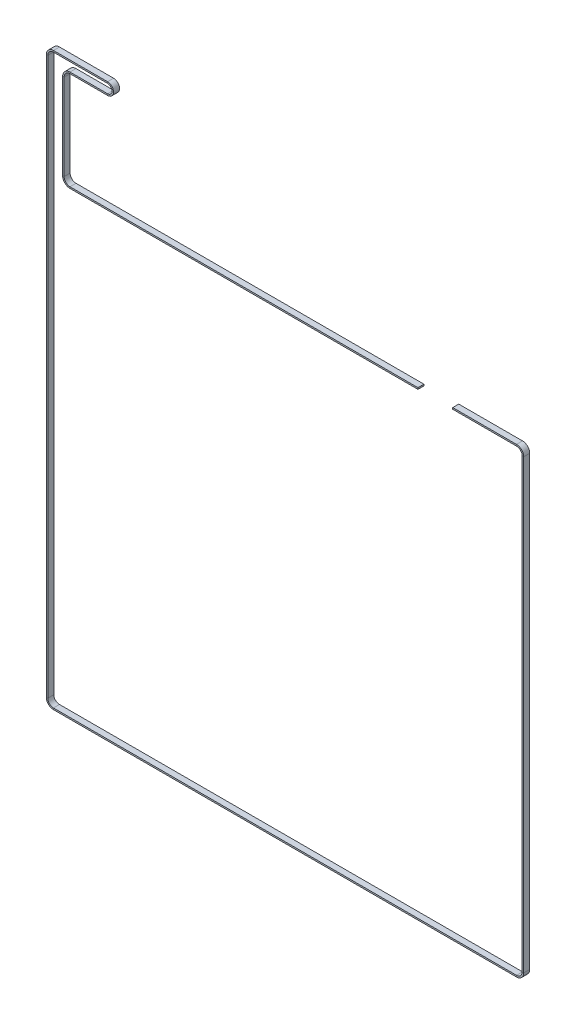
from build123d import *

# Parameters (mm, degrees)
SKETCH2_W = 6
SKETCH2_H = 1.5


with BuildPart() as part:
    # Sweep1: sweep along a path in Sketch1
    with BuildLine(Plane(origin=(0, -21, 4.45), x_dir=(1, 0, 0), z_dir=(0, 0, 1))) as sweep1_path:
        Line((391.85, -35.67158816), (455.5, -35.67158816))
        ThreePointArc((455.5, -35.67158816), (460.00780573, -37.53878243), (461.875, -42.04658816))
        Line((461.875, -42.04658816), (461.875, -488))
        ThreePointArc((461.875, -488), (460.00780573, -492.50780573), (455.5, -494.375))
        Line((455.5, -494.375), (-6.5, -494.375))
        ThreePointArc((-6.5, -494.375), (-11.00780573, -492.50780573), (-12.875, -488))
        Line((-12.875, -488), (-12.875, 67.325))
        ThreePointArc((-12.875, 67.325), (-11.00780573, 71.83280573), (-6.5, 73.7))
        Line((-6.5, 73.7), (47.5, 73.7))
        ThreePointArc((47.5, 73.7), (52.7, 68.5), (47.5, 63.3))
        Line((47.5, 63.3), (10, 63.3))
        ThreePointArc((10, 63.3), (5.333095244, 61.366904756), (3.4, 56.7))
        Line((3.4, 56.7), (3.4, -29.22158816))
        ThreePointArc((3.4, -29.22158816), (5.333095244, -33.888492916), (10, -35.82158816))
        Line((10, -35.82158816), (357.15, -35.82158816))
    # Sketch2 → Sweep1 (sweep)
    with BuildSketch(Plane(origin=(391.85, -56.67158816, 4.45), x_dir=(0, 0, 1), z_dir=(-1, 0, 0))):
        Rectangle(SKETCH2_W, SKETCH2_H)
    sweep(path=sweep1_path.line)


solid = part.part
